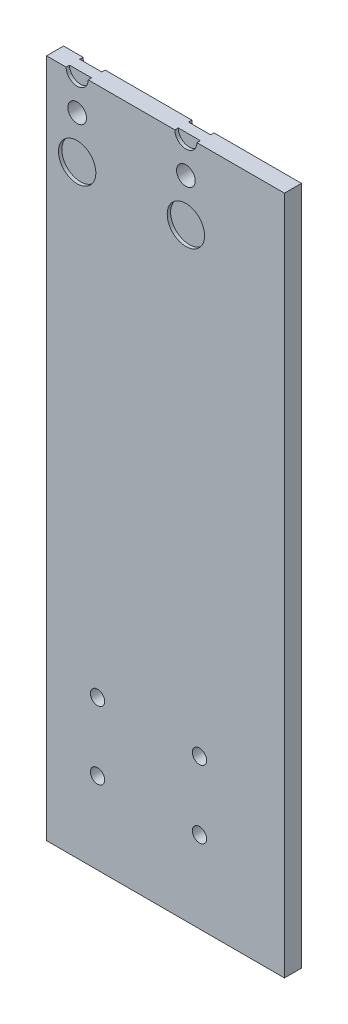
from build123d import *

# Parameters (mm, degrees)
SKETCH_1_W          = 100
SKETCH_1_H          = 200
EXTRUDE_1_DEPTH     = 5
CUT_EXTRUDE_2_DEPTH = 0.001
M4X0_7_HELICOIL_1_D = 4.2
SKETCH_13_W         = 10
SKETCH_13_H         = 200
CUT_EXTRUDE_4_DEPTH = 10
SKETCH_14_W         = 10
SKETCH_14_H         = 200
CUT_EXTRUDE_5_DEPTH = 10
SKETCH_15_R         = 3.25
SKETCH_15_R_2       = 5.5
CUT_EXTRUDE_6_DEPTH = 1
SKETCH_16_R         = 2.75
CUT_EXTRUDE_7_DEPTH = 108.819293394


with BuildPart() as part:
    # 스케치1 → 보스-돌출1 (new body)
    with BuildSketch(Plane.XY):
        Rectangle(SKETCH_1_W, SKETCH_1_H)
    extrude(amount=EXTRUDE_1_DEPTH)

    # 스케치3 → 컷-돌출2 (cut)
    # profile 1 of 5: a face of its own
    with BuildSketch(Plane(origin=(0, 0, 0), x_dir=(-1, 0, 0), z_dir=(0, 0, -1))):
        with BuildLine():
            Line((1.435897436, 3.568709936), (1.435897436, 3.241987179))
            add(Edge.make_bspline(
                [(1.435897436, 3.241987179), (1.406158657, 3.253938052), (1.349713836, 3.276621056), (1.26647346, 3.301285681), (1.189944626, 3.317221421), (1.140790736, 3.319457366), (1.117588141, 3.320512821)],
                knots=[0, 0, 0, 0, 1.16548392, 2.212112691, 3.15604595, 4, 4, 4, 4], degree=3))
            add(Edge.make_bspline(
                [(1.117588141, 3.320512821), (1.101914377, 3.31986148), (1.071575198, 3.318600703), (1.027971871, 3.312172427), (0.988682661, 3.299069626), (0.953777041, 3.28204035), (0.924826581, 3.260686166), (0.900040357, 3.239230902), (0.882073827, 3.215045722), (0.872318879, 3.192525311), (0.866368878, 3.171674318), (0.86457875, 3.150320052), (0.860193836, 3.124095966), (0.858971029, 3.091932248), (0.856183661, 3.054829537), (0.856430302, 3.012002641), (0.854146379, 2.964125498), (0.854488293, 2.930224949), (0.854667468, 2.912459936)],
                knots=[0, 0, 0, 0, 1.311993654, 2.539582093, 3.670788641, 4.763509788, 5.772417512, 6.671800701, 7.496729179, 8.266799162, 8.712543678, 9.304149002, 10.05334463, 10.934920737, 11.99209668, 13.165090968, 14.514413552, 16, 16, 16, 16], degree=3))
            Line((0.854667468, 2.912459936), (0.854667468, 2.557692308))
            Line((0.854667468, 2.557692308), (1.391025641, 2.557692308))
            Line((1.391025641, 2.557692308), (1.391025641, 2.243589744))
            Line((1.391025641, 2.243589744), (0.853966346, 2.243589744))
            Line((0.853966346, 2.243589744), (0.852564103, 0))
            Line((0.852564103, 0), (0.538461538, 0))
            Line((0.538461538, 0), (0.538461538, 2.243589744))
            Line((0.538461538, 2.243589744), (0.179487179, 2.243589744))
            Line((0.179487179, 2.243589744), (0.179487179, 2.557692308))
            Line((0.179487179, 2.557692308), (0.538461538, 2.557692308))
            Line((0.538461538, 2.557692308), (0.538461538, 2.966446314))
            add(Edge.make_bspline(
                [(0.538461538, 2.966446314), (0.538486753, 2.989121894), (0.538535124, 3.032622798), (0.541922975, 3.095232239), (0.544818696, 3.153055703), (0.550586323, 3.205644336), (0.557248029, 3.253490479), (0.566784189, 3.29588336), (0.57579556, 3.333965119), (0.592144152, 3.377067776), (0.616566371, 3.4259178), (0.656096568, 3.4775417), (0.703489575, 3.523846647), (0.760097899, 3.562854), (0.823813434, 3.595269478), (0.894694612, 3.618511331), (0.97196981, 3.631651776), (1.02545728, 3.633605985), (1.053084936, 3.634615385)],
                knots=[0, 0, 0, 0, 1.116398763, 2.141702935, 3.087165306, 3.966655413, 4.746276475, 5.464069668, 6.106083417, 6.67047701, 7.730773247, 8.782666744, 9.856985883, 10.980834087, 12.154321827, 13.366232824, 14.639591414, 16, 16, 16, 16], degree=3))
            add(Edge.make_bspline(
                [(1.053084936, 3.634615385), (1.081161694, 3.633658004), (1.140107358, 3.631648034), (1.232303961, 3.619214627), (1.331900478, 3.597743597), (1.400236399, 3.578665712), (1.435897436, 3.568709936)],
                knots=[0, 0, 0, 0, 0.864728408, 1.815451418, 2.859995356, 4, 4, 4, 4], degree=3))
        make_face()
    # profile 2 of 5: a face of its own
    with BuildSketch(Plane(origin=(0, 0, 0), x_dir=(-1, 0, 0), z_dir=(0, 0, -1))):
        with BuildLine():
            Line((1.794871795, 2.557692308), (2.108974359, 2.557692308))
            Line((2.108974359, 2.557692308), (2.108974359, 2.181189904))
            add(Edge.make_bspline(
                [(2.108974359, 2.181189904), (2.132163118, 2.216245732), (2.176511439, 2.283289731), (2.250224368, 2.371959032), (2.325727699, 2.445374079), (2.403382887, 2.503877598), (2.483760987, 2.547690717), (2.565097938, 2.579783752), (2.648673408, 2.598761067), (2.704835332, 2.601294726), (2.732972756, 2.602564103)],
                knots=[0, 0, 0, 0, 1.2804753, 2.448899062, 3.506932113, 4.484331642, 5.4025378, 6.288909075, 7.142734305, 8, 8, 8, 8], degree=3))
            add(Edge.make_bspline(
                [(2.732972756, 2.602564103), (2.754799083, 2.601373576), (2.799708168, 2.59892399), (2.867690758, 2.581713165), (2.93773421, 2.554235143), (2.982876597, 2.52839492), (3.006410256, 2.514923878)],
                knots=[0, 0, 0, 0, 0.901110191, 1.854092781, 2.881294221, 4, 4, 4, 4], degree=3))
            Line((3.006410256, 2.514923878), (2.833934295, 2.242888622))
            add(Edge.make_bspline(
                [(2.833934295, 2.242888622), (2.818825274, 2.249628888), (2.790145459, 2.262423203), (2.748190893, 2.277565213), (2.709509556, 2.286481129), (2.684865998, 2.287831847), (2.673377404, 2.288461538)],
                knots=[0, 0, 0, 0, 1.180555205, 2.24091978, 3.179933427, 4, 4, 4, 4], degree=3))
            add(Edge.make_bspline(
                [(2.673377404, 2.288461538), (2.64817167, 2.286781501), (2.59675928, 2.283354712), (2.521274781, 2.256415904), (2.448027575, 2.212890664), (2.389855913, 2.164619552), (2.34481366, 2.118071755), (2.312673435, 2.077423352), (2.283190688, 2.031844721), (2.255020467, 1.982115037), (2.229354173, 1.927385191), (2.205399504, 1.868201977), (2.183740641, 1.804496849), (2.171390397, 1.760114328), (2.165064103, 1.737379808)],
                knots=[0, 0, 0, 0, 1.125678352, 2.296057538, 3.5422874, 4.923748041, 5.663163013, 6.437101912, 7.23742474, 8.08941207, 8.991984279, 9.93940061, 10.944477711, 12, 12, 12, 12], degree=3))
            add(Edge.make_bspline(
                [(2.165064103, 1.737379808), (2.160331709, 1.717102634), (2.149849818, 1.672190235), (2.13965828, 1.596841711), (2.129588762, 1.507818052), (2.122492143, 1.404871459), (2.115914101, 1.288259015), (2.112204019, 1.15780307), (2.109100878, 1.013369718), (2.109017812, 0.912395365), (2.108974359, 0.859575321)],
                knots=[0, 0, 0, 0, 0.566838948, 1.255505196, 2.06880316, 3.007127437, 4.065329342, 5.249902469, 6.561414163, 8, 8, 8, 8], degree=3))
            Line((2.108974359, 0.859575321), (2.108974359, 0))
            Line((2.108974359, 0), (1.794871795, 0))
            Line((1.794871795, 0), (1.794871795, 2.557692308))
        make_face()
    # profile 3 of 5: a face of its own
    with BuildSketch(Plane(origin=(0, 0, 0), x_dir=(-1, 0, 0), z_dir=(0, 0, -1))):
        with BuildLine():
            add(Edge.make_bspline(
                [(4.555889423, 2.602564103), (4.603880696, 2.601542211), (4.697979853, 2.599538533), (4.835787739, 2.578123567), (4.967332875, 2.545376203), (5.093119067, 2.500104641), (5.211535363, 2.43942269), (5.324306607, 2.367013399), (5.431123616, 2.281230805), (5.495146645, 2.214872737), (5.527644231, 2.181189904)],
                knots=[0, 0, 0, 0, 1.054011418, 2.066658804, 3.057071809, 4.030435133, 4.997543892, 5.974964718, 6.972108034, 8, 8, 8, 8], degree=3))
            add(Edge.make_bspline(
                [(5.527644231, 2.181189904), (5.555626185, 2.148975918), (5.611048565, 2.085171376), (5.682114284, 1.981715763), (5.743335844, 1.874575662), (5.792398805, 1.762328336), (5.831083829, 1.645953664), (5.858549525, 1.525051653), (5.87488646, 1.399889306), (5.877089427, 1.314885468), (5.878205128, 1.271834936)],
                knots=[0, 0, 0, 0, 1.025258237, 2.030674902, 3.01204498, 3.988269485, 4.97094183, 5.956517959, 6.965070386, 8, 8, 8, 8], degree=3))
            add(Edge.make_bspline(
                [(5.878205128, 1.271834936), (5.877223791, 1.228534878), (5.875284623, 1.142971945), (5.856941006, 1.016952579), (5.82840992, 0.894757756), (5.787578082, 0.776899063), (5.735219973, 0.663016235), (5.671329285, 0.553606686), (5.595457668, 0.448454553), (5.509453671, 0.348452714), (5.414401795, 0.2562865), (5.311285647, 0.17595823), (5.202131613, 0.107136706), (5.08548826, 0.05170029), (4.962420773, 0.00799059), (4.832663705, -0.022709427), (4.696418635, -0.04127111), (4.603391413, -0.043654684), (4.555889423, -0.044871795)],
                knots=[0, 0, 0, 0, 0.998656419, 1.973391657, 2.932242238, 3.890759089, 4.846373663, 5.82037756, 6.809684879, 7.83454468, 8.860553229, 9.859544525, 10.845671541, 11.83227036, 12.833544569, 13.85385346, 14.904124723, 16, 16, 16, 16], degree=3))
            add(Edge.make_bspline(
                [(4.555889423, -0.044871795), (4.508154704, -0.043650599), (4.414663844, -0.041258824), (4.277937862, -0.022781541), (4.147948243, 0.007976441), (4.024719644, 0.051843934), (3.907574798, 0.107138478), (3.797788301, 0.175750167), (3.694588385, 0.256310322), (3.599516401, 0.348446259), (3.513517795, 0.448456216), (3.437644787, 0.553606254), (3.373754461, 0.663016348), (3.321396257, 0.776899033), (3.280564444, 0.894757764), (3.252033351, 1.016952577), (3.233689737, 1.142971945), (3.231750568, 1.228534878), (3.230769231, 1.271834936)],
                knots=[0, 0, 0, 0, 1.099876186, 2.154163076, 3.173186993, 4.173200201, 5.163417411, 6.152872554, 7.150605724, 8.17532212, 9.198891216, 10.186952605, 11.159729845, 12.11414092, 13.071450619, 14.029093627, 15.002601286, 16, 16, 16, 16], degree=3))
            add(Edge.make_bspline(
                [(3.230769231, 1.271834936), (3.231892541, 1.314651482), (3.234116503, 1.399420884), (3.250437012, 1.524347945), (3.277795568, 1.645045334), (3.316526965, 1.76097081), (3.366042155, 1.872726246), (3.426403443, 1.980131077), (3.498194076, 2.083118877), (3.553396027, 2.146840957), (3.581330128, 2.179086538)],
                knots=[0, 0, 0, 0, 1.031353054, 2.041901799, 3.029428768, 4.008703097, 4.981709435, 5.96992636, 6.972712378, 8, 8, 8, 8], degree=3))
            add(Edge.make_bspline(
                [(3.581330128, 2.179086538), (3.613778719, 2.213061478), (3.677594583, 2.279879174), (3.784943311, 2.365411698), (3.897437132, 2.439327772), (4.017162058, 2.498803987), (4.142844916, 2.545642505), (4.275064159, 2.57820802), (4.413339674, 2.599461375), (4.507899295, 2.601519553), (4.555889423, 2.602564103)],
                knots=[0, 0, 0, 0, 1.027980169, 2.021703884, 2.998553061, 3.971491411, 4.943284454, 5.930300938, 6.949603206, 8, 8, 8, 8], degree=3))
        make_face()
        with BuildLine():
            add(Edge.make_bspline(
                [(4.554487179, 2.288461538), (4.520549568, 2.287496947), (4.453550439, 2.285592664), (4.354930855, 2.27110876), (4.259990701, 2.248161255), (4.168549857, 2.215557199), (4.080916684, 2.1734583), (3.997007282, 2.12174994), (3.916574842, 2.061116984), (3.841192779, 1.991654312), (3.772010466, 1.915775317), (3.71153249, 1.834926959), (3.660107384, 1.750420612), (3.617267225, 1.662168401), (3.585360036, 1.569275987), (3.562187014, 1.472795356), (3.547716774, 1.37252994), (3.545830395, 1.304368921), (3.544871795, 1.269731571)],
                knots=[0, 0, 0, 0, 1.021534396, 2.016698045, 2.994645724, 3.958388632, 4.93408049, 5.916473867, 6.921342795, 7.962252576, 8.998418191, 10.008913653, 10.997312074, 11.973003931, 12.956656626, 13.948281152, 14.957379055, 16, 16, 16, 16], degree=3))
            add(Edge.make_bspline(
                [(3.544871795, 1.269731571), (3.546478619, 1.224979543), (3.549667863, 1.136155138), (3.575603099, 1.005344015), (3.618989379, 0.879762163), (3.677576659, 0.760145777), (3.750982878, 0.649473499), (3.837469944, 0.550802015), (3.936109645, 0.465616203), (4.045726145, 0.394935358), (4.164080463, 0.338775602), (4.289336784, 0.298976626), (4.419977478, 0.273104934), (4.509258209, 0.270533459), (4.554487179, 0.269230769)],
                knots=[0, 0, 0, 0, 1.016792936, 2.018143844, 3.017858371, 4.030088057, 5.03801393, 6.028138512, 7.003788237, 7.991172063, 8.984598303, 9.972568034, 10.972917682, 12, 12, 12, 12], degree=3))
            add(Edge.make_bspline(
                [(4.554487179, 0.269230769), (4.599713548, 0.270541049), (4.688989144, 0.273127506), (4.819448321, 0.298846326), (4.944362293, 0.338949987), (5.062593681, 0.394872197), (5.172160284, 0.465884611), (5.271509405, 0.550320988), (5.357258017, 0.64973484), (5.430591621, 0.760292369), (5.490138364, 0.879576721), (5.533321566, 1.005367193), (5.559319152, 1.136149235), (5.562499981, 1.224977566), (5.564102564, 1.269731571)],
                knots=[0, 0, 0, 0, 1.02726834, 2.027799167, 3.010890988, 4.004497153, 4.992059811, 5.971914811, 6.958719428, 7.966827853, 8.981595046, 9.981490638, 10.983022906, 12, 12, 12, 12], degree=3))
            add(Edge.make_bspline(
                [(5.564102564, 1.269731571), (5.563144294, 1.304369128), (5.561258565, 1.372530554), (5.546783601, 1.472793007), (5.523628061, 1.569284604), (5.491656444, 1.662136607), (5.44900243, 1.750649112), (5.396585637, 1.834678839), (5.336354611, 1.916055385), (5.26633749, 1.991409026), (5.191034113, 2.061144062), (5.110569074, 2.121773452), (5.026784096, 2.173231047), (4.939405513, 2.215917288), (4.847952945, 2.247864628), (4.753145816, 2.271241259), (4.654947006, 2.285531456), (4.588187963, 2.287478598), (4.554487179, 2.288461538)],
                knots=[0, 0, 0, 0, 1.042956736, 2.052379634, 3.044323526, 4.02829302, 5.004299113, 5.996692471, 7.007513377, 8.048758398, 9.090003419, 10.095195979, 11.07790575, 12.047570684, 13.018257071, 13.989683339, 14.985167495, 16, 16, 16, 16], degree=3))
        make_face(mode=Mode.SUBTRACT)
    # profile 4 of 5: a face of its own
    with BuildSketch(Plane(origin=(0, 0, 0), x_dir=(-1, 0, 0), z_dir=(0, 0, -1))):
        with BuildLine():
            Line((6.506410256, 2.557692308), (6.820512821, 2.557692308))
            Line((6.820512821, 2.557692308), (6.820512821, 2.096354167))
            add(Edge.make_bspline(
                [(6.820512821, 2.096354167), (6.854050456, 2.13819689), (6.919131407, 2.219394153), (7.02751574, 2.326114728), (7.14205964, 2.414059953), (7.262061644, 2.484163747), (7.387684654, 2.537010373), (7.518162924, 2.575176304), (7.65427763, 2.598061132), (7.746842067, 2.601051363), (7.793669872, 2.602564103)],
                knots=[0, 0, 0, 0, 1.12780773, 2.188550248, 3.19190651, 4.159438251, 5.104880172, 6.052711206, 7.014878035, 8, 8, 8, 8], degree=3))
            add(Edge.make_bspline(
                [(7.793669872, 2.602564103), (7.841000506, 2.600818907), (7.933637974, 2.597403139), (8.068516035, 2.570386448), (8.194489429, 2.524241192), (8.311108985, 2.461029122), (8.416236198, 2.382422649), (8.508561049, 2.290844867), (8.584924297, 2.185508784), (8.63612166, 2.087785627), (8.669847307, 2.001096833), (8.691079645, 1.926850083), (8.709110626, 1.844131932), (8.724742374, 1.753192343), (8.735319486, 1.653394153), (8.743661778, 1.545146461), (8.749640472, 1.42848433), (8.749877679, 1.347797703), (8.75, 1.306189904)],
                knots=[0, 0, 0, 0, 1.235846778, 2.418850247, 3.575807741, 4.728682307, 5.871620074, 6.994088408, 8.11269785, 9.256955736, 9.865816715, 10.540099792, 11.271859618, 12.076849838, 12.949306005, 13.892391288, 14.913166135, 16, 16, 16, 16], degree=3))
            Line((8.75, 1.306189904), (8.75, 0))
            Line((8.75, 0), (8.435897436, 0))
            Line((8.435897436, 0), (8.435897436, 1.203125))
            add(Edge.make_bspline(
                [(8.435897436, 1.203125), (8.435704228, 1.237947445), (8.435334654, 1.304556856), (8.434169007, 1.399925879), (8.431359201, 1.486412457), (8.427410888, 1.563809825), (8.421631857, 1.632043661), (8.415609226, 1.691252938), (8.408244249, 1.74136248), (8.401681336, 1.771527563), (8.398737981, 1.78505609)],
                knots=[0, 0, 0, 0, 1.430800155, 2.736877192, 3.918605307, 4.986035426, 5.920637409, 6.731861385, 7.431261377, 8, 8, 8, 8], degree=3))
            add(Edge.make_bspline(
                [(8.398737981, 1.78505609), (8.388112449, 1.824767275), (8.367661589, 1.901199019), (8.317127605, 2.004873372), (8.253313425, 2.09307156), (8.175415575, 2.165248281), (8.0841865, 2.221419118), (7.979879357, 2.260393073), (7.863500716, 2.284769342), (7.781646334, 2.287196474), (7.738982372, 2.288461538)],
                knots=[0, 0, 0, 0, 1.084156227, 2.086665306, 3.027808233, 3.945421172, 4.874247719, 5.839848303, 6.874090471, 8, 8, 8, 8], degree=3))
            add(Edge.make_bspline(
                [(7.738982372, 2.288461538), (7.713714688, 2.287985534), (7.663710595, 2.287043533), (7.589560623, 2.277592235), (7.51763645, 2.262133779), (7.447216241, 2.241265142), (7.379708447, 2.212602873), (7.312944156, 2.180073502), (7.249437392, 2.13952529), (7.187833995, 2.094334669), (7.130521187, 2.044255462), (7.077192849, 1.991410952), (7.029654829, 1.935135348), (6.986586153, 1.8763354), (6.94940789, 1.814203562), (6.916954802, 1.749339256), (6.889419107, 1.681657107), (6.875736415, 1.634682046), (6.868890224, 1.611177885)],
                knots=[0, 0, 0, 0, 1.023777757, 2.026029729, 3.023749952, 4.003683103, 4.997618607, 5.993177895, 7.010360494, 8.046726602, 9.087585522, 10.09234134, 11.086953743, 12.070360549, 13.043493632, 14.017870808, 15.008233677, 16, 16, 16, 16], degree=3))
            add(Edge.make_bspline(
                [(6.868890224, 1.611177885), (6.864950576, 1.593922682), (6.856374167, 1.556359007), (6.847110987, 1.494714588), (6.838703412, 1.423404613), (6.831666453, 1.342512296), (6.827361037, 1.251754421), (6.82266664, 1.151518583), (6.820957579, 1.041405094), (6.820665225, 0.964743402), (6.820512821, 0.924779647)],
                knots=[0, 0, 0, 0, 0.615963638, 1.340920617, 2.168419149, 3.115676021, 4.16674242, 5.331190069, 6.6087489, 8, 8, 8, 8], degree=3))
            Line((6.820512821, 0.924779647), (6.820512821, 0))
            Line((6.820512821, 0), (6.506410256, 0))
            Line((6.506410256, 0), (6.506410256, 2.557692308))
        make_face()
    # profile 5 of 5: a face of its own
    with BuildSketch(Plane(origin=(0, 0, 0), x_dir=(-1, 0, 0), z_dir=(0, 0, -1))):
        Polygon((9.782051282, 3.58974359), (10.096153846, 3.58974359), (10.096153846, 2.557692308), (10.544871795, 2.557692308), (10.544871795, 2.243589744), (10.096153846, 2.243589744), (10.096153846, 0), (9.782051282, 0), (9.782051282, 2.243589744), (9.333333333, 2.243589744), (9.333333333, 2.557692308), (9.782051282, 2.557692308), align=None)
    extrude(amount=-CUT_EXTRUDE_2_DEPTH, mode=Mode.SUBTRACT)

    # M4x0.7 Helicoil용 탭 구멍1 (through all)
    with Locations(Plane(origin=(0, 0, -5), x_dir=(-1, 0, 0), z_dir=(0, 0, -1))):
        with Locations((-5, -76), (25, -76), (-5, -56), (25, -56)):
            Hole(M4X0_7_HELICOIL_1_D / 2)

    # 스케치13 → 컷-돌출4 (cut)
    with BuildSketch(Plane.XY.offset(5)):
        with Locations((45, 0)):
            Rectangle(SKETCH_13_W, SKETCH_13_H)
        with Locations((-45, 0)):
            Rectangle(SKETCH_13_W, SKETCH_13_H)
    extrude(amount=-CUT_EXTRUDE_4_DEPTH, mode=Mode.SUBTRACT)

    # 스케치14 → 컷-돌출5 (cut)
    with BuildSketch(Plane.XY.offset(5)):
        with Locations((35, 0)):
            Rectangle(SKETCH_14_W, SKETCH_14_H)
    extrude(amount=-CUT_EXTRUDE_5_DEPTH, mode=Mode.SUBTRACT)

    # 스케치15 → 컷-돌출6 (cut)
    with BuildSketch(Plane(origin=(0, 0, 5), x_dir=(-1, 0, 0), z_dir=(0, 0, -1))):
        with Locations((-1, 100)):
            Circle(SKETCH_15_R)
        with Locations((31, 100)):
            Circle(SKETCH_15_R)
        with Locations((-1, 77.4)):
            Circle(SKETCH_15_R_2)
        with Locations((31, 77.4)):
            Circle(SKETCH_15_R_2)
    cut_extrude_6 = extrude(amount=CUT_EXTRUDE_6_DEPTH, mode=Mode.SUBTRACT)

    # 스케치16 → 컷-돌출7 (cut, through all)
    with BuildSketch(Plane(origin=(0, 0, 0), x_dir=(-1, 0, 0), z_dir=(0, 0, -1))):
        with Locations((-1, 90)):
            Circle(SKETCH_16_R)
        with Locations((31, 90)):
            Circle(SKETCH_16_R)
    extrude(amount=-CUT_EXTRUDE_7_DEPTH, mode=Mode.SUBTRACT)

    # 대칭 복사1: 컷-돌출6 across plane
    add(cut_extrude_6.mirror(Plane.XY.offset(2.5)), mode=Mode.SUBTRACT)


solid = part.part
